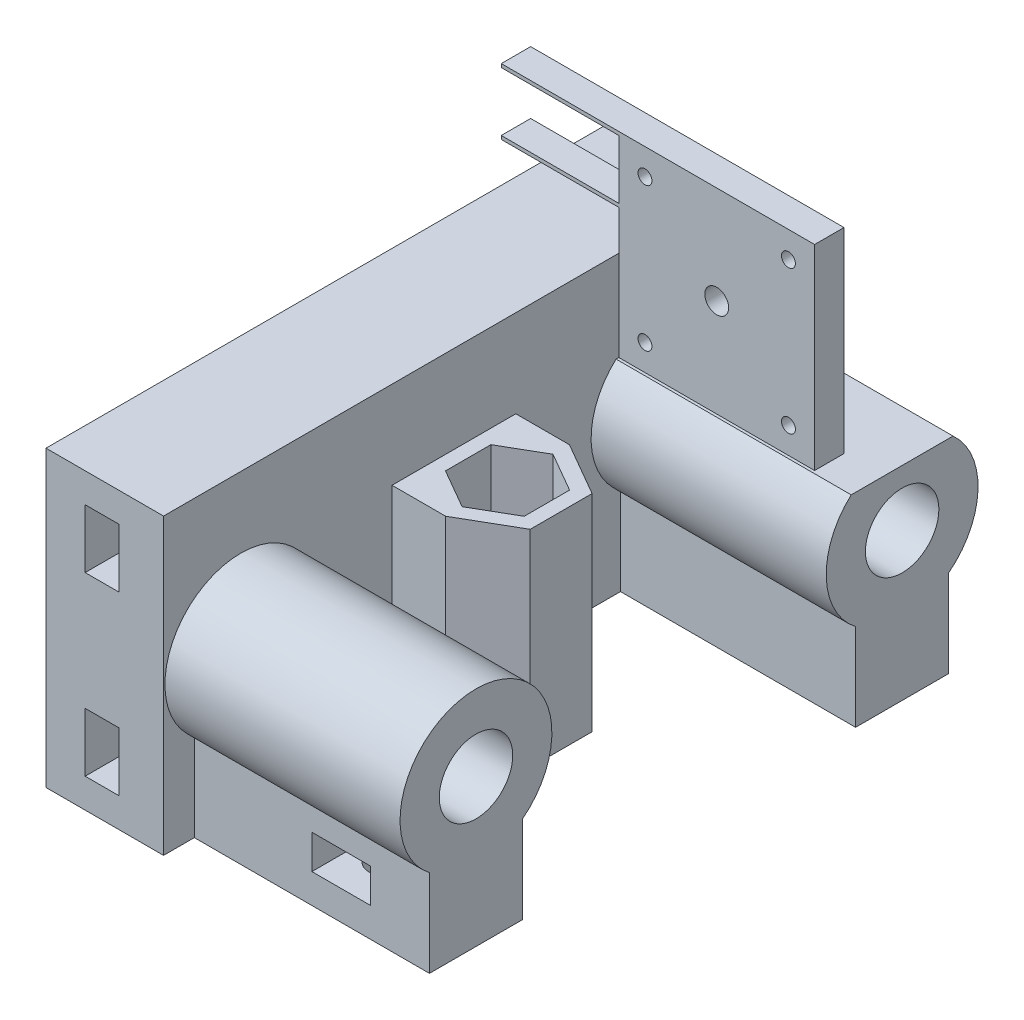
from build123d import *
from build123d.topology import SkipClean

# Parameters (mm, degrees)
SKETCH1_W                 = 88.9
SKETCH1_H                 = 76.2
BOSS_EXTRUDE1_DEPTH       = 25.4
SKETCH2_R                 = 3.96875
CUT_EXTRUDE1_DEPTH        = 19.05
SKETCH5_W                 = 88.9
SKETCH5_H                 = 0.127
BOSS_EXTRUDE2_DEPTH       = 50.8
SKETCH6_R                 = 16.40416582
SKETCH6_R_2               = 7.9375
BOSS_EXTRUDE3_DEPTH       = 50.8
BOSS_EXTRUDE4_DEPTH       = 18.288
SKETCH8_W                 = 50.8
SKETCH8_H                 = 20.10833164
BOSS_EXTRUDE5_DEPTH       = 27.94
CUT_EXTRUDE6_REACH        = 153.994
CUT_EXTRUDE6_END_RADIUS   = 7.9375
SKETCH13_W                = 6.35
SKETCH13_H                = 7.366
CUT_EXTRUDE7_DEPTH        = 22.9616
BOSS_EXTRUDE6_DEPTH       = 50.8
CUT_EXTRUDE8_REACH        = 153.93
SKETCH14_3_R              = 5.25
CUT_EXTRUDE9_DEPTH        = 9
CUT_EXTRUDE10_REACH       = 153.93
SKETCH16_W                = 50.8
SKETCH16_H                = 6.64633418
BOSS_EXTRUDE7_DEPTH       = 50.8
BOSS_EXTRUDE9_START       = 19.05
BOSS_EXTRUDE9_DEPTH       = 19.05
SKETCH22_W                = 7.366
SKETCH22_H                = 12.7
CUT_EXTRUDE15_DEPTH       = 28.4988
MIRROR5_START             = 19.05
MIRROR5_COPY_1_DEPTH      = 19.05
MIRROR5_COPY_2_SKETCH_W   = 7.366
MIRROR5_COPY_2_SKETCH_H   = 12.7
MIRROR5_COPY_2_DEPTH      = 28.4988
SKETCH25_R                = 5
BOSS_EXTRUDE10_DEPTH      = 6.35
SKETCH26_W                = 25.4
SKETCH26_H                = 125.476
CUT_EXTRUDE16_DEPTH       = 6.35
CUT_EXTRUDE17_DEPTH       = 6.35
SKETCH30_W                = 22.00640822
SKETCH30_H                = 4.23756582
CUT_EXTRUDE18_DEPTH       = 50.8
SKETCH31_W                = 6.35
SKETCH31_H                = 42.299999982
BOSS_EXTRUDE13_DEPTH      = 42.3
SKETCH34_R                = 1.5
SKETCH34_R_2              = 2.575
CUT_EXTRUDE20_DEPTH       = 12.7
CUT_EXTRUDE21_START       = -86.426787815
CUT_EXTRUDE21_OUTLINE_R   = 11.075
CUT_EXTRUDE21_OUTLINE_R_2 = 2.575
CUT_EXTRUDE21_DEPTH       = 2.1
SKETCH38_W                = 6.35
SKETCH38_H                = 0.75
BOSS_EXTRUDE16_DEPTH      = 25.4


# Read off the part's stored shape, not the designer's step: Cut-Extrude21
with BuildPart() as part:
    # Sketch1 → Boss-Extrude1 (new body)
    with BuildSketch(Plane(origin=(0, 0, 0), x_dir=(0, 0, -1), z_dir=(1, 0, 0))):
        with Locations((44.45, 38.1)):
            Rectangle(SKETCH1_W, SKETCH1_H)
    extrude(amount=BOSS_EXTRUDE1_DEPTH)

    # Sketch2 → Cut-Extrude1 (cut)
    with BuildSketch(Plane.ZY):
        with Locations((-85.09, 19.05)):
            Circle(SKETCH2_R)
        with Locations((-3.81, 57.15)):
            Circle(SKETCH2_R)
        with Locations((-3.81, 19.05)):
            Circle(SKETCH2_R)
        with Locations((-85.09, 57.15)):
            Circle(SKETCH2_R)
    extrude(amount=-CUT_EXTRUDE1_DEPTH, mode=Mode.SUBTRACT)

    # Sketch5 → Boss-Extrude2 (add)
    with BuildSketch(Plane(origin=(25.4, 0, 0), x_dir=(0, 0, -1), z_dir=(1, 0, 0))):
        with Locations((44.45, 0.0635)):
            Rectangle(SKETCH5_W, SKETCH5_H)
    extrude(amount=BOSS_EXTRUDE2_DEPTH)

    # Sketch6 → Boss-Extrude3 (add)
    # profile 1 of 2: a face of its own
    with BuildSketch(Plane(origin=(25.4, 0, 0), x_dir=(0, 0, -1), z_dir=(1, 0, 0))):
        with Locations(Location((-1.5875, 38.1635, 0), (0, 0, 275.553444483))):
            Circle(SKETCH6_R)
        with Locations(Location((-1.5875, 38.1635, 0), (0, 0, 78.463040967))):
            Circle(SKETCH6_R_2, mode=Mode.SUBTRACT)
    # profile 2 of 2: a face of its own
    with BuildSketch(Plane(origin=(25.4, 0, 0), x_dir=(0, 0, -1), z_dir=(1, 0, 0))):
        with Locations(Location((90.4875, 38.1635, 0), (0, 0, 264.446555517))):
            Circle(SKETCH6_R)
        with Locations(Location((90.4875, 38.1635, 0), (0, 0, 101.536959033))):
            Circle(SKETCH6_R_2, mode=Mode.SUBTRACT)
    extrude(amount=BOSS_EXTRUDE3_DEPTH)

    # Sketch7 → Boss-Extrude4 (add)
    with BuildSketch(Plane.XY):
        Polygon((76.2, 0.127), (25.4, 0.127), (25.4, 76.2), (0, 76.2), (0, 58.26125), (19.05, 58.26125), (19.05, 56.03875), (0, 56.03875), (0, 20.16125), (19.05, 20.16125), (19.05, 17.93875), (0, 17.93875), (0, 0), (76.2, 0), align=None)
    boss_extrude4 = extrude(amount=BOSS_EXTRUDE4_DEPTH)

    # Mirror2: Boss-Extrude4 across plane
    add(boss_extrude4.mirror(Plane.XY.offset(-44.45)))

    # Sketch8 → Boss-Extrude5 (add)
    with BuildSketch(Plane(origin=(0, 0.127, 0), x_dir=(1, 0, 0), z_dir=(0, 1, 0))):
        with Locations((50.8, -1.5875)):
            Rectangle(SKETCH8_W, SKETCH8_H)
    boss_extrude5 = extrude(amount=BOSS_EXTRUDE5_DEPTH)

    # Cut-Extrude6: up to this cylinder (the profile starts outside it)
    cut_extrude6_end = Plane(origin=(57.15, 38.1635, 1.5875), z_dir=(-1, 0, 0)) * Cylinder(CUT_EXTRUDE6_END_RADIUS, 324.863, mode=Mode.PRIVATE)
    # Sketch12 → Cut-Extrude6 (cut, up to the surface)
    with BuildSketch(Plane.XZ, mode=Mode.PRIVATE) as cut_extrude6_sk1:
        with BuildLine():
            ThreePointArc((53.18125, 1.5875), (57.15, -2.38125), (61.11875, 1.5875))
            Line((61.11875, 1.5875), (53.18125, 1.5875))
        make_face()
    cut_extrude6_tool1 = extrude(cut_extrude6_sk1.sketch, amount=-CUT_EXTRUDE6_REACH, mode=Mode.PRIVATE) - cut_extrude6_end
    # Sketch12 → Cut-Extrude6 (cut, up to the surface)
    with BuildSketch(Plane.XZ, mode=Mode.PRIVATE) as cut_extrude6_sk2:
        with BuildLine():
            Line((53.18125, 1.5875), (61.11875, 1.5875))
            ThreePointArc((61.11875, 1.5875), (57.15, 5.55625), (53.18125, 1.5875))
        make_face()
    cut_extrude6_tool2 = extrude(cut_extrude6_sk2.sketch, amount=-CUT_EXTRUDE6_REACH, mode=Mode.PRIVATE) - cut_extrude6_end
    # Sketch12 → Cut-Extrude6 (cut, up to the surface)
    with BuildSketch(Plane.XZ, mode=Mode.PRIVATE) as cut_extrude6_sk3:
        with BuildLine():
            ThreePointArc((53.18125, 1.5875), (57.15, -2.38125), (61.11875, 1.5875))
            Line((61.11875, 1.5875), (53.18125, 1.5875))
        make_face()
    cut_extrude6_tool3 = extrude(cut_extrude6_sk3.sketch, amount=-CUT_EXTRUDE6_REACH, mode=Mode.PRIVATE) - cut_extrude6_end
    # Sketch12 → Cut-Extrude6 (cut, up to the surface)
    with BuildSketch(Plane.XZ, mode=Mode.PRIVATE) as cut_extrude6_sk4:
        with BuildLine():
            Line((53.18125, 1.5875), (61.11875, 1.5875))
            ThreePointArc((61.11875, 1.5875), (57.15, 5.55625), (53.18125, 1.5875))
        make_face()
    cut_extrude6_tool4 = extrude(cut_extrude6_sk4.sketch, amount=-CUT_EXTRUDE6_REACH, mode=Mode.PRIVATE) - cut_extrude6_end
    cut_extrude6 = cut_extrude6_tool1.solids().sort_by_distance((57.15, 0, -0.09689))[0] + cut_extrude6_tool2.solids().sort_by_distance((57.15, 0, 3.27189))[0] + cut_extrude6_tool3.solids().sort_by_distance((57.15, 0, -0.09689))[0] + cut_extrude6_tool4.solids().sort_by_distance((57.15, 0, 3.27189))[0]
    add(cut_extrude6, mode=Mode.SUBTRACT)

    # Sketch13 → Cut-Extrude7 (cut)
    with BuildSketch(Plane.XY.offset(18.288)):
        with Locations((60.325, 16.383)):
            Rectangle(SKETCH13_W, SKETCH13_H)
        with Locations((53.975, 16.383)):
            Rectangle(SKETCH13_W, SKETCH13_H)
    cut_extrude7 = extrude(amount=-CUT_EXTRUDE7_DEPTH, mode=Mode.SUBTRACT)

    # Mirror3: Boss-Extrude5, Cut-Extrude6, Cut-Extrude7 across plane
    add(boss_extrude5.mirror(Plane.XY.offset(-44.45)))
    add(cut_extrude6.mirror(Plane.XY.offset(-44.45)), mode=Mode.SUBTRACT)
    add(cut_extrude7.mirror(Plane.XY.offset(-44.45)), mode=Mode.SUBTRACT)

    # Sketch14 → Boss-Extrude6 (add)
    with BuildSketch(Plane(origin=(0, 0.127, 0), x_dir=(1, 0, 0), z_dir=(0, 1, 0))):
        Polygon((48.563230368, 37.763351356), (48.563230368, 51.136648644), (36.981615184, 57.823297288), (25.4, 51.136648644), (25.4, 37.763351356), (36.981615184, 31.076702712), align=None)
        Polygon((28.481615184, 49.357477288), (28.481615184, 39.542522712), (36.981615184, 34.635045424), (45.481615184, 39.542522712), (45.481615184, 49.357477288), (36.981615184, 54.264954576), align=None, mode=Mode.SUBTRACT)
    extrude(amount=BOSS_EXTRUDE6_DEPTH)

    # Sketch14<3> → Cut-Extrude8 (cut, up to next)
    with BuildSketch(Plane(origin=(0, 0.127, 0), x_dir=(1, 0, 0), z_dir=(0, 1, 0)), mode=Mode.PRIVATE) as cut_extrude8_sk1:
        with Locations(Location((36.981615184, 44.45, 0), (0, 0, 270))):
            Circle(SKETCH14_3_R)
    cut_extrude8_tool1 = extrude(cut_extrude8_sk1.sketch, amount=-CUT_EXTRUDE8_REACH, mode=Mode.PRIVATE) & part.part
    add(cut_extrude8_tool1.solids().sort_by_distance((36.981615, 0.127, -44.45))[0], mode=Mode.SUBTRACT)

    # Sketch15 → Cut-Extrude9 (cut)
    with BuildSketch(Plane.XZ):
        Polygon((45.531615184, -39.513655198), (36.981615184, -34.577310397), (28.431615184, -39.513655198), (28.431615184, -49.386344802), (36.981615184, -54.322689603), (45.531615184, -49.386344802), align=None)
    extrude(amount=-CUT_EXTRUDE9_DEPTH, mode=Mode.SUBTRACT)

    # Sketch16 → Cut-Extrude10 (cut, up to next)
    with BuildSketch(Plane(origin=(0, 0.127, 0), x_dir=(1, 0, 0), z_dir=(0, 1, 0)), mode=Mode.PRIVATE) as cut_extrude10_sk1:
        Polygon((48.563230368, 37.763351356), (36.981615184, 31.076702712), (25.4, 31.076702712), (25.4, 8.46666582), (76.2, 8.46666582), (76.2, 80.43333418), (25.4, 80.43333418), (25.4, 57.823297288), (36.981615184, 57.823297288), (48.563230368, 51.136648644), align=None)
    cut_extrude10_tool1 = extrude(cut_extrude10_sk1.sketch, amount=-CUT_EXTRUDE10_REACH, mode=Mode.PRIVATE) & part.part
    # Sketch16 → Cut-Extrude10 (cut, up to next)
    with BuildSketch(Plane(origin=(0, 0.127, 0), x_dir=(1, 0, 0), z_dir=(0, 1, 0)), mode=Mode.PRIVATE) as cut_extrude10_sk2:
        with Locations((50.8, -14.96483291)):
            Rectangle(SKETCH16_W, SKETCH16_H)
    cut_extrude10_tool2 = extrude(cut_extrude10_sk2.sketch, amount=-CUT_EXTRUDE10_REACH, mode=Mode.PRIVATE) & part.part
    # Sketch16 → Cut-Extrude10 (cut, up to next)
    with BuildSketch(Plane(origin=(0, 0.127, 0), x_dir=(1, 0, 0), z_dir=(0, 1, 0)), mode=Mode.PRIVATE) as cut_extrude10_sk3:
        with Locations((50.8, 103.86483291)):
            Rectangle(SKETCH16_W, SKETCH16_H)
    cut_extrude10_tool3 = extrude(cut_extrude10_sk3.sketch, amount=-CUT_EXTRUDE10_REACH, mode=Mode.PRIVATE) & part.part
    add(cut_extrude10_tool1.solids().sort_by_distance((53.397723, 0.127, -44.45))[0], mode=Mode.SUBTRACT)
    add(cut_extrude10_tool2.solids().sort_by_distance((50.8, 0.127, 14.964833))[0], mode=Mode.SUBTRACT)
    add(cut_extrude10_tool3.solids().sort_by_distance((50.8, 0.127, -103.864833))[0], mode=Mode.SUBTRACT)

    # Sketch18 → Boss-Extrude7 (add)
    with BuildSketch(Plane(origin=(0, 0.127, 0), x_dir=(1, 0, 0), z_dir=(0, 1, 0))):
        Polygon((36.981615184, 57.823297288), (25.4, 57.823297288), (25.4, 51.136648644), align=None)
        Polygon((25.4, 37.763351356), (25.4, 31.076702712), (36.981615184, 31.076702712), align=None)
    extrude(amount=BOSS_EXTRUDE7_DEPTH)

    # Sketch20 → Boss-Extrude9 (add)
    with SkipClean():  # the faces are left unmerged after this step: merging them gives an invalid solid
        with BuildSketch(Plane.ZY.offset(-19.05).offset(BOSS_EXTRUDE9_START)):
            with BuildLine():
                ThreePointArc((0.15875, 19.05), (0.118862053, 18.488733992), (0, 17.93875))
                Line((0, 17.93875), (18.288, 17.93875))
                Line((18.288, 17.93875), (18.288, 20.16125))
                Line((18.288, 20.16125), (0, 20.16125))
                ThreePointArc((0, 20.16125), (0.118862053, 19.611266008), (0.15875, 19.05))
            make_face()
        boss_extrude9 = extrude(amount=-BOSS_EXTRUDE9_DEPTH)

    # Sketch22 → Cut-Extrude15 (cut)
    with SkipClean():  # the faces are left unmerged after this step: merging them gives an invalid solid
        with BuildSketch(Plane.XY.offset(18.288)):
            with Locations((12.1412, 19.05)):
                Rectangle(SKETCH22_W, SKETCH22_H)
        cut_extrude15 = extrude(amount=-CUT_EXTRUDE15_DEPTH, mode=Mode.SUBTRACT)

    # Mirror4: Boss-Extrude9, Cut-Extrude15 across plane
    with SkipClean():  # the faces are left unmerged after this step: merging them gives an invalid solid
        add(boss_extrude9.mirror(Plane.XY.offset(-44.45)))
        add(cut_extrude15.mirror(Plane.XY.offset(-44.45)), mode=Mode.SUBTRACT)

    # Mirror5: Boss-Extrude9, Cut-Extrude15 across plane
    with SkipClean():  # the faces are left unmerged after this step: merging them gives an invalid solid
        add(boss_extrude9.mirror(Plane.ZX.offset(38.1)))
        add(cut_extrude15.mirror(Plane.ZX.offset(38.1)), mode=Mode.SUBTRACT)

    # Mirror5 copy 1 sketch → Mirror5 copy 1 (add)
    with BuildSketch(Plane(origin=(19.05, 76.2, -88.9), x_dir=(0, 0, -1), z_dir=(-1, 0, 0)).offset(MIRROR5_START)):
        with BuildLine():
            ThreePointArc((0.15875, 19.05), (0.118862053, 18.488733992), (0, 17.93875))
            Line((0, 17.93875), (18.288, 17.93875))
            Line((18.288, 17.93875), (18.288, 20.16125))
            Line((18.288, 20.16125), (0, 20.16125))
            ThreePointArc((0, 20.16125), (0.118862053, 19.611266008), (0.15875, 19.05))
        make_face()
    extrude(amount=-MIRROR5_COPY_1_DEPTH)

    # Mirror5 copy 2 sketch → Mirror5 copy 2 (cut)
    with BuildSketch(Plane(origin=(0, 76.2, -107.188), x_dir=(1, 0, 0), z_dir=(0, 0, -1))):
        with Locations((12.1412, 19.05)):
            Rectangle(MIRROR5_COPY_2_SKETCH_W, MIRROR5_COPY_2_SKETCH_H)
    extrude(amount=-MIRROR5_COPY_2_DEPTH, mode=Mode.SUBTRACT)

    # Sketch25 → Boss-Extrude10 (add)
    with BuildSketch(Plane(origin=(0, 15.350000034, 0), x_dir=(-1, 0, 0), z_dir=(0, -1, 0))):
        Polygon((-36.981615184, 34.577310397), (-28.431615184, 39.513655198), (-28.431615184, 49.386344802), (-36.981615184, 54.322689603), (-45.531615184, 49.386344802), (-45.531615184, 39.513655198), align=None)
        with Locations(Location((-36.981615184, 44.45, 0), (0, 0, 90))):
            Circle(SKETCH25_R, mode=Mode.SUBTRACT)
    extrude(amount=-BOSS_EXTRUDE10_DEPTH)

    # Sketch26 → Cut-Extrude16 (cut)
    with SkipClean():  # the faces are left unmerged after this step: merging them gives an invalid solid
        with BuildSketch(Plane(origin=(0, 76.2, 0), x_dir=(1, 0, 0), z_dir=(0, 1, 0))):
            with Locations((12.7, 44.45)):
                Rectangle(SKETCH26_W, SKETCH26_H)
        extrude(amount=-CUT_EXTRUDE16_DEPTH, mode=Mode.SUBTRACT)

    # Sketch27 → Cut-Extrude17 (cut)
    with SkipClean():  # the faces are left unmerged after this step: merging them gives an invalid solid
        with BuildSketch(Plane.XZ):
            Polygon((25.4, -107.188), (25.4, -100.54166582), (76.2, -100.54166582), (76.2, -80.43333418), (25.4, -80.43333418), (25.4, -57.823297288), (36.981615184, -57.823297288), (48.563230368, -51.136648644), (48.563230368, -37.763351356), (36.981615184, -31.076702712), (25.4, -31.076702712), (25.4, -8.46666582), (76.2, -8.46666582), (76.2, 11.64166582), (25.4, 11.64166582), (25.4, 18.288), (0, 18.288), (0, -107.188), align=None)
        extrude(amount=-CUT_EXTRUDE17_DEPTH, mode=Mode.SUBTRACT)

    # Sketch30 → Cut-Extrude18 (cut)
    with SkipClean():  # the faces are left unmerged after this step: merging them gives an invalid solid
        with BuildSketch(Plane(origin=(76.2, 0, 0), x_dir=(0, 0, -1), z_dir=(1, 0, 0))):
            with Locations((90.4875, 52.44888291)):
                Rectangle(SKETCH30_W, SKETCH30_H)
        extrude(amount=-CUT_EXTRUDE18_DEPTH, mode=Mode.SUBTRACT)

    # Sketch31 → Boss-Extrude13 (add)
    with SkipClean():  # the faces are left unmerged after this step: merging them gives an invalid solid
        with BuildSketch(Plane(origin=(25.4, 0, 0), x_dir=(0, 0, -1), z_dir=(1, 0, 0))):
            with Locations((83.251787815, 71.480099991)):
                Rectangle(SKETCH31_W, SKETCH31_H)
        extrude(amount=BOSS_EXTRUDE13_DEPTH)

    # Sketch34 → Cut-Extrude20 (cut)
    with SkipClean():  # the faces are left unmerged after this step: merging them gives an invalid solid
        with BuildSketch(Plane(origin=(0, 0, -86.426787815), x_dir=(-1, 0, 0), z_dir=(0, 0, -1))):
            with Locations((-62.05, 55.9689)):
                Circle(SKETCH34_R)
            with Locations((-31.05, 55.9689)):
                Circle(SKETCH34_R)
            with Locations((-62.05, 86.9689)):
                Circle(SKETCH34_R)
            with Locations((-46.55, 71.480099991)):
                Circle(SKETCH34_R_2)
            with Locations((-31.05, 86.9689)):
                Circle(SKETCH34_R)
        extrude(amount=-CUT_EXTRUDE20_DEPTH, mode=Mode.SUBTRACT)

    # Cut-Extrude21 outline → Cut-Extrude21 (cut)
    with SkipClean():  # the faces are left unmerged after this step: merging them gives an invalid solid
        with BuildSketch(Plane.XY.offset(CUT_EXTRUDE21_START)):
            with Locations((46.55, 71.480099991)):
                Circle(CUT_EXTRUDE21_OUTLINE_R)
            with Locations((46.55, 71.480099991)):
                Circle(CUT_EXTRUDE21_OUTLINE_R_2, mode=Mode.SUBTRACT)
        extrude(amount=CUT_EXTRUDE21_DEPTH, mode=Mode.SUBTRACT)

    # Sketch38 → Boss-Extrude16 (add)
    with SkipClean():  # the faces are left unmerged after this step: merging them gives an invalid solid
        with BuildSketch(Plane.ZY.offset(-25.4)):
            with Locations((-83.251787815, 92.255099982)):
                Rectangle(SKETCH38_W, SKETCH38_H)
            with Locations((-83.251787815, 78.805099982)):
                Rectangle(SKETCH38_W, SKETCH38_H)
        extrude(amount=BOSS_EXTRUDE16_DEPTH)


solid = part.part
